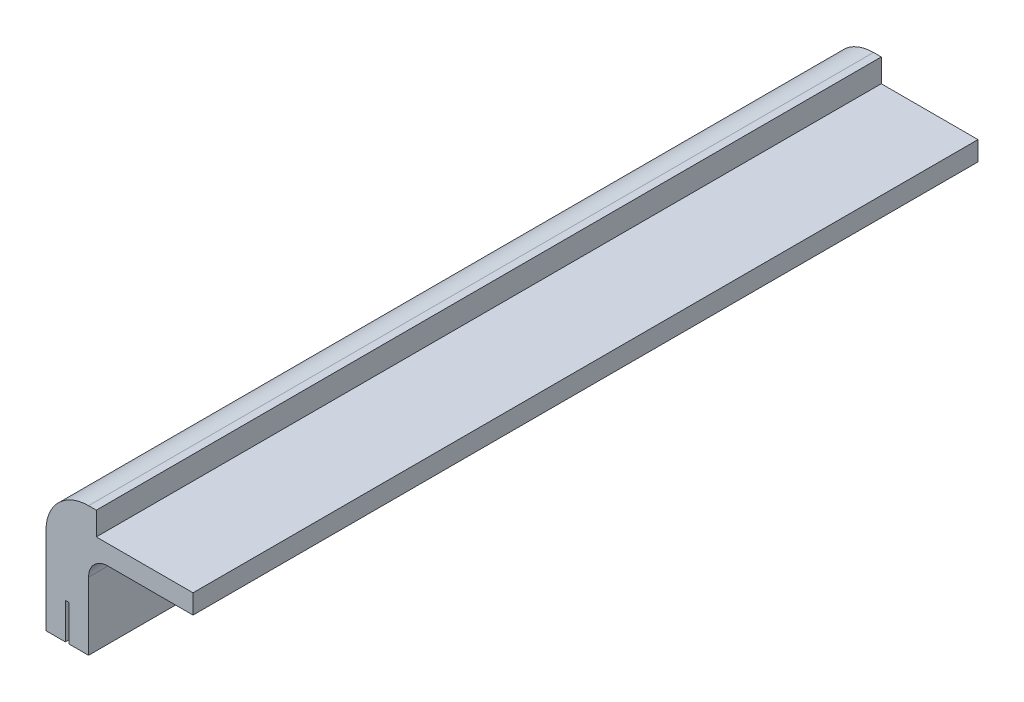
from build123d import *

# Parameters (mm, degrees)
BOSS_EXTRUDE1_DEPTH = 405.754616144
SKETCH2_W           = 405.754616144
SKETCH2_H           = 10
CUT_EXTRUDE1_DEPTH  = 11.5
CAVITY1_START       = 240
CAVITY1_OUTLINE_W   = 38.5
CAVITY1_OUTLINE_H   = 405.754616144
CAVITY1_DEPTH       = 2
SKETCH3_W           = 405.754616144
SKETCH3_H           = 10
CUT_EXTRUDE2_DEPTH  = 38.5


# Read off the part's stored shape, not the designer's step: Cavity1
with BuildPart() as part:
    # Sketch1 → Boss-Extrude1 (new body)
    with BuildSketch(Plane(origin=(0, 0, 546.614427926), x_dir=(-1, 0, 0), z_dir=(0, 0, -1))):
        with BuildLine():
            Line((141, 242), (152.5, 242))
            Line((152.5, 242), (152.5, 240))
            Line((152.5, 240), (141, 240))
            Line((141, 240), (141, 230))
            Line((141, 230), (185, 230))
            ThreePointArc((185, 230), (192.071067812, 227.071067812), (195, 220))
            Line((195, 220), (195, 185))
            Line((195, 185), (205, 185))
            Line((205, 185), (205, 203.610753203))
            Line((205, 203.610753203), (207, 203.610753203))
            Line((207, 203.610753203), (207, 185))
            Line((207, 185), (217, 185))
            Line((217, 185), (217, 230))
            ThreePointArc((217, 230), (210.556349186, 245.556349186), (195, 252))
            Line((195, 252), (141, 252))
            Line((141, 252), (141, 242))
        make_face()
    extrude(amount=BOSS_EXTRUDE1_DEPTH)

    # Sketch2 → Cut-Extrude1 (cut)
    with BuildSketch(Plane(origin=(-141, 0, 0), x_dir=(0, 0, -1), z_dir=(1, 0, 0))):
        with Locations((-343.737119854, 247)):
            Rectangle(SKETCH2_W, SKETCH2_H)
    extrude(amount=-CUT_EXTRUDE1_DEPTH, mode=Mode.SUBTRACT)

    # Cavity1 outline → Cavity1 (cut)
    with BuildSketch(Plane(origin=(0, 0, 0), x_dir=(1, 0, 0), z_dir=(0, 1, 0)).offset(CAVITY1_START)):
        with Locations((-171.75, -343.737119854)):
            Rectangle(CAVITY1_OUTLINE_W, CAVITY1_OUTLINE_H)
    extrude(amount=CAVITY1_DEPTH, mode=Mode.SUBTRACT)

    # Sketch3 → Cut-Extrude2 (cut)
    with BuildSketch(Plane(origin=(-152.5, 0, 0), x_dir=(0, 0, -1), z_dir=(1, 0, 0))):
        with Locations((-343.737119854, 247)):
            Rectangle(SKETCH3_W, SKETCH3_H)
    extrude(amount=-CUT_EXTRUDE2_DEPTH, mode=Mode.SUBTRACT)


solid = part.part
